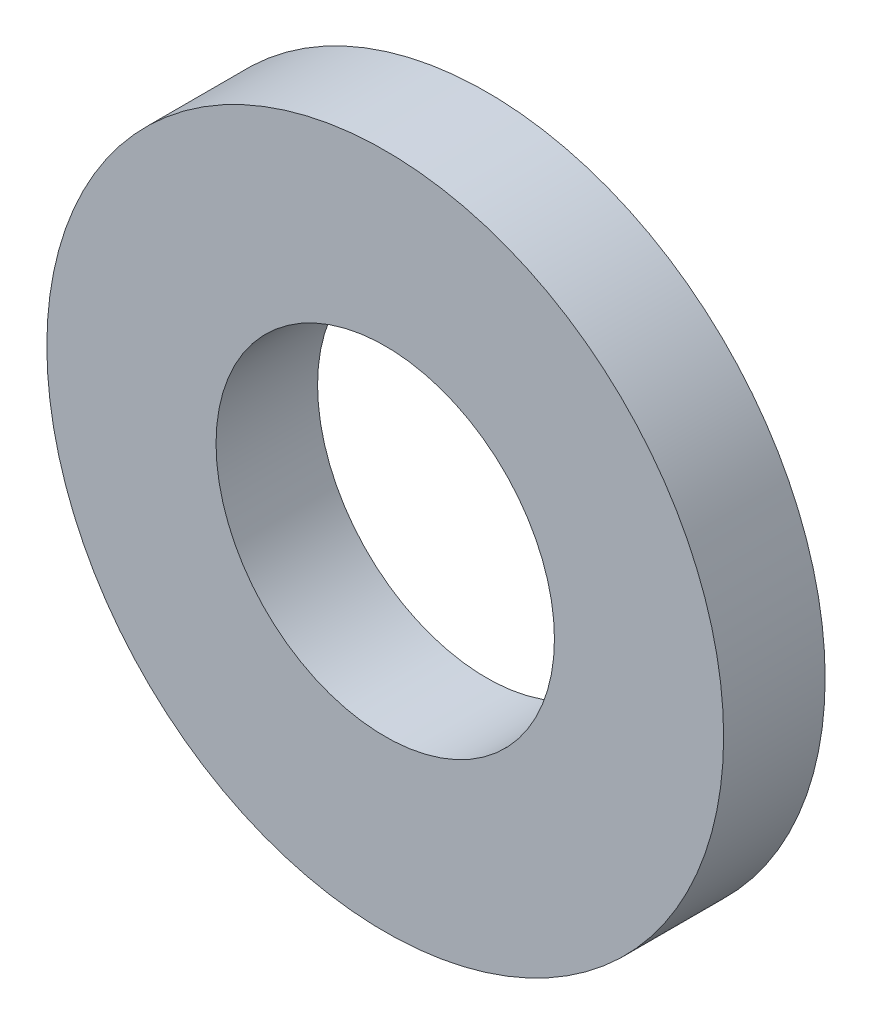
from build123d import *

# Parameters (mm, degrees)
SKETCH_1_R      = 5
SKETCH_1_R_2    = 2.5
EXTRUDE_1_DEPTH = 1.5


with BuildPart() as part:
    # Эскиз1 → Бобышка-Вытянуть1 (new body)
    with BuildSketch(Plane.XY):
        Circle(SKETCH_1_R)
        Circle(SKETCH_1_R_2, mode=Mode.SUBTRACT)
    extrude(amount=EXTRUDE_1_DEPTH)


solid = part.part
